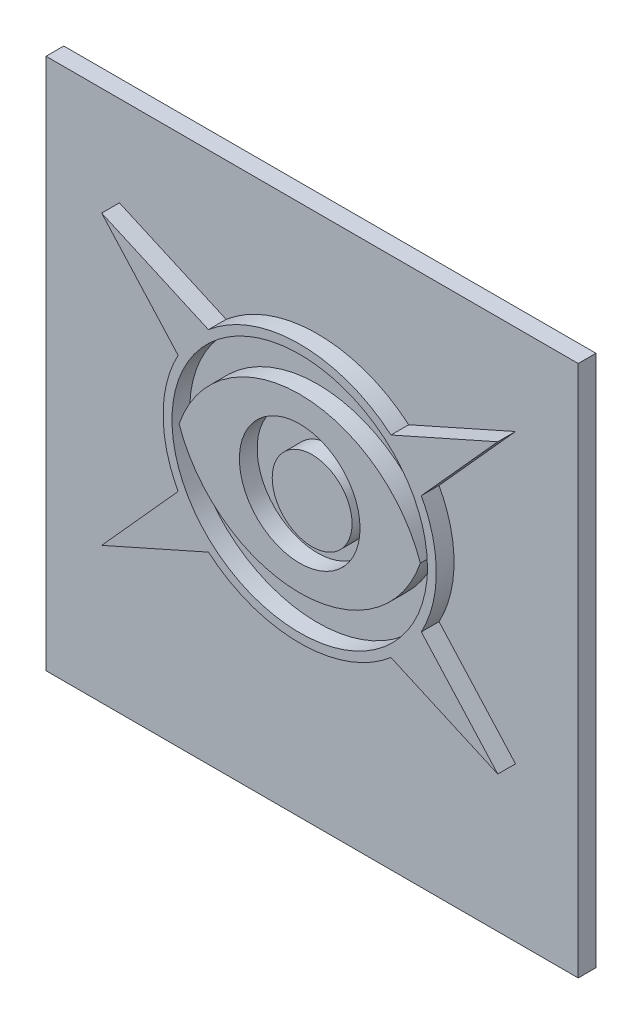
from build123d import *

# Parameters (mm, degrees)
SKICA1_W                      = 300
SKICA1_H                      = 300
P_IDAT_VYSUNUT_M1_DEPTH       = 10
P_IDAT_VYSUNUT_M2_OUTLINE_R   = 34
P_IDAT_VYSUNUT_M2_OUTLINE_R_2 = 22.5
P_IDAT_VYSUNUT_M2_DEPTH       = 10


# Read off the part's stored shape, not the designer's step: Přidat vysunutím2
with BuildPart() as part:
    # Skica1 → Přidat vysunutím1 (new body)
    with BuildSketch(Plane.XY):
        with Locations((150, 150)):
            Rectangle(SKICA1_W, SKICA1_H)
    extrude(amount=P_IDAT_VYSUNUT_M1_DEPTH)

    # Přidat vysunutím2 outline → Přidat vysunutím2 (add)
    # profile 1 of 3: a face of its own
    with BuildSketch(Plane.XY.offset(10)):
        with BuildLine():
            Line((264.644345224, 249.114364816), (204.448257064, 222.313339624))
            add(Edge.make_bspline(
                [(204.448257064, 222.313339624), (153, 266.115859509), (101.551742936, 222.313339624)],
                knots=[0.839064453, 0.839064453, 0.839064453, 2.302528201, 2.302528201, 2.302528201], degree=2, weights=[1, 0.744018351, 1]))
            Line((101.551742936, 222.313339624), (41.355654776, 249.114364816))
            Line((41.355654776, 249.114364816), (84.451742425, 201.251310533))
            add(Edge.make_bspline(
                [(84.451742425, 201.251310533), (66.506189511, 168), (84.451742425, 134.748689467)],
                knots=[2.668661787, 2.668661787, 2.668661787, 3.614523521, 3.614523521, 3.614523521], degree=2, weights=[1, 0.890237111, 1]))
            Line((84.451742425, 134.748689467), (41.355654776, 86.885635184))
            Line((41.355654776, 86.885635184), (101.551742936, 113.686660376))
            add(Edge.make_bspline(
                [(101.551742936, 113.686660376), (153, 69.884140491), (204.448257064, 113.686660376)],
                knots=[3.980657106, 3.980657106, 3.980657106, 5.444120855, 5.444120855, 5.444120855], degree=2, weights=[1, 0.744018351, 1]))
            Line((204.448257064, 113.686660376), (264.644345224, 86.885635184))
            Line((264.644345224, 86.885635184), (221.548257575, 134.748689467))
            add(Edge.make_bspline(
                [(221.548257575, 134.748689467), (239.493810489, 168), (221.548257575, 201.251310533)],
                knots=[5.81025444, 5.81025444, 5.81025444, 6.756116174, 6.756116174, 6.756116174], degree=2, weights=[1, 0.890237111, 1]))
            Line((221.548257575, 201.251310533), (264.644345224, 249.114364816))
        make_face()
        with BuildLine():
            add(Edge.make_bspline(
                [(225, 168), (225, 176.864581058), (221.284259047, 194.593743175), (205.346766645, 217.22941635), (181.371826698, 232.430212202), (153, 237.784893899), (129.11147608, 233.276356498), (112.212158133, 224.593414956), (102.642030231, 216.993953421), (95.923468043, 209.682344585), (90.126433793, 201.707291075), (83.28831958, 188.170345197), (79.350635096, 167.005143483), (84.715740953, 141.406256825), (100.653233355, 118.77058365), (124.628173302, 103.569787798), (153, 98.215106101), (181.371826698, 103.569787798), (205.346766645, 118.77058365), (221.284259047, 141.406256825), (225, 159.135418942), (225, 168)],
                knots=[0, 0, 0, 0, 0.392699082, 0.785398163, 1.178097245, 1.570796327, 1.963495408, 2.170032115, 2.366381656, 2.481498811, 2.596615966, 2.792965507, 3.141592654, 3.534291735, 3.926990817, 4.319689899, 4.71238898, 5.105088062, 5.497787144, 5.890486225, 6.283185307, 6.283185307, 6.283185307, 6.283185307], degree=3))
        make_face(mode=Mode.SUBTRACT)
    # profile 2 of 3: a face of its own
    with BuildSketch(Plane.XY.offset(10)):
        with BuildLine():
            ThreePointArc((221, 168), (153, 216.5), (85, 168))
            ThreePointArc((85, 168), (153, 119.5), (221, 168))
        make_face()
        with Locations((153, 168)):
            Circle(P_IDAT_VYSUNUT_M2_OUTLINE_R, mode=Mode.SUBTRACT)
    # profile 3 of 3: a face of its own
    with BuildSketch(Plane.XY.offset(10)):
        with Locations((160, 168)):
            Circle(P_IDAT_VYSUNUT_M2_OUTLINE_R_2)
    extrude(amount=P_IDAT_VYSUNUT_M2_DEPTH)


solid = part.part
